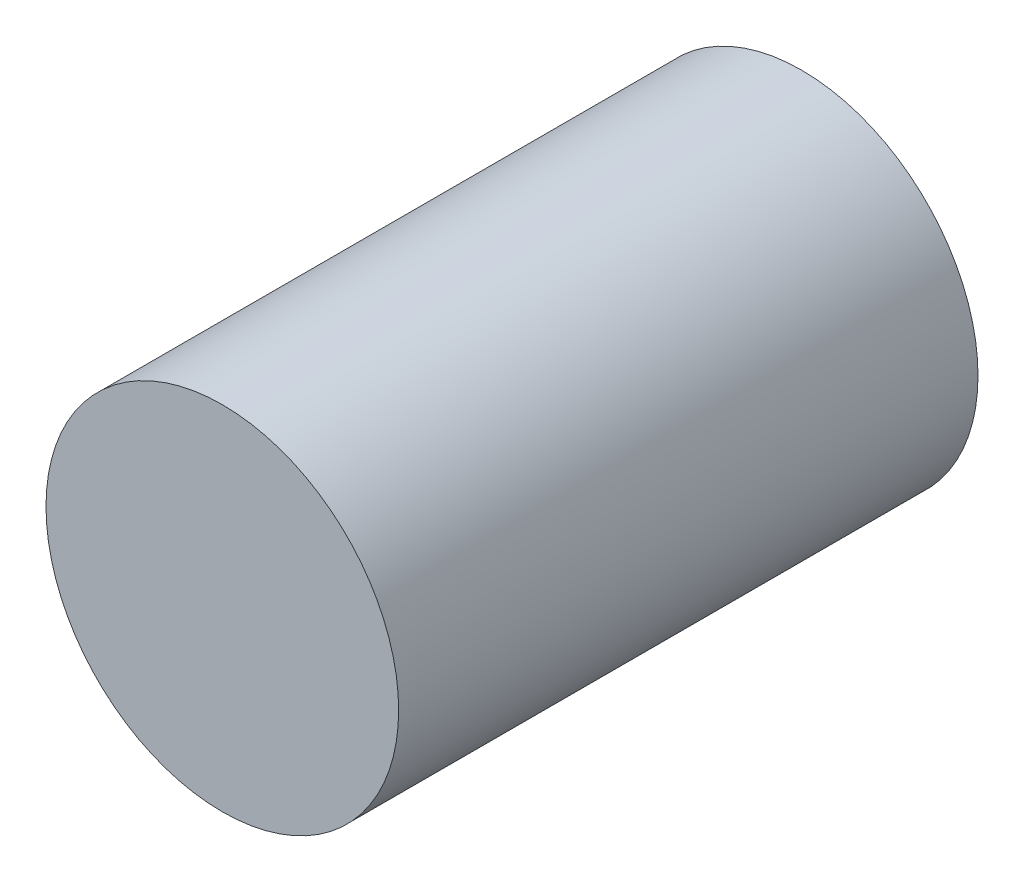
from build123d import *

# Parameters (mm, degrees)
SKETCH1_R           = 7
BOSS_EXTRUDE1_DEPTH = 23


with BuildPart() as part:
    # Sketch1 → Boss-Extrude1 (new body)
    with BuildSketch(Plane.XY):
        Circle(SKETCH1_R)
    extrude(amount=BOSS_EXTRUDE1_DEPTH)


solid = part.part
